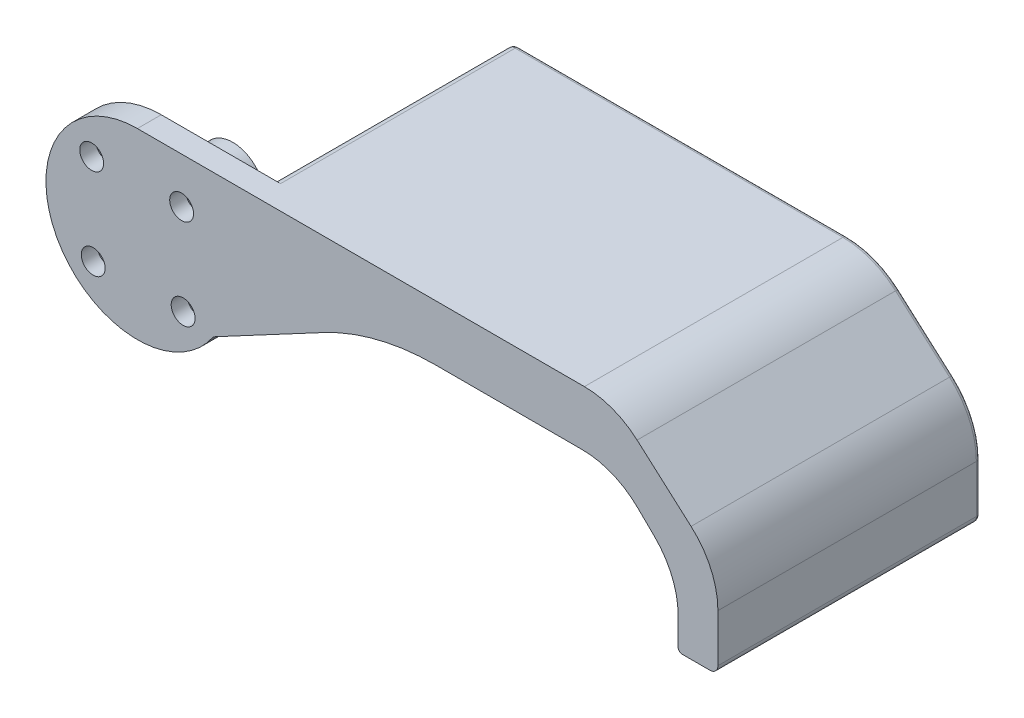
from build123d import *

# Parameters (mm, degrees)
SZKIC1_R                    = 11.5
DODANIE_WYCI_GNI_CIE1_DEPTH = 3
SZKIC2_R                    = 4
DODANIE_WYCI_GNI_CIE2_DEPTH = 9
SZKIC3_R                    = 1.5
WYTNIJ_WYCI_GNI_CIE1_DEPTH  = 2
DODANIE_WYCI_GNI_CIE3_DEPTH = 3
DODANIE_WYCI_GNI_CIE4_DEPTH = 30
ZAOKR_GLENIE1_R             = 10
ZAOKR_GLENIE2_R             = 30
ZAOKR_GLENIE6_R             = 1
ZAOKR_GLENIE8_R             = 0.5
ZAOKR_GLENIE9_R             = 0.5


with BuildPart() as part:
    # Szkic1 → Dodanie-wyciągnięcie1 (new body)
    with BuildSketch(Plane.XY):
        with Locations((68.25, -14)):
            Circle(SZKIC1_R)
    extrude(amount=DODANIE_WYCI_GNI_CIE1_DEPTH)

    # Szkic2 → Dodanie-wyciągnięcie2 (add)
    with BuildSketch(Plane(origin=(0, 0, 0), x_dir=(-1, 0, 0), z_dir=(0, 0, -1))):
        with Locations((-68.25, -14)):
            Circle(SZKIC2_R)
    extrude(amount=DODANIE_WYCI_GNI_CIE2_DEPTH)

    # Szkic3 → Wytnij-wyciągnięcie1 (cut)
    with BuildSketch(Plane.XY.offset(3)):
        with Locations((74.000947528, -19.561169169)):
            Circle(SZKIC3_R)
        with Locations((73.811169169, -8.249052472)):
            Circle(SZKIC3_R)
        with Locations((62.499052472, -8.438830831)):
            Circle(SZKIC3_R)
        with Locations((62.688830831, -19.750947528)):
            Circle(SZKIC3_R)
    extrude(amount=-WYTNIJ_WYCI_GNI_CIE1_DEPTH, mode=Mode.SUBTRACT)

    # Szkic4 → Dodanie-wyciągnięcie3 (add)
    with BuildSketch(Plane.XY.offset(3)):
        Polygon((68.25, -2.5), (128.25, -2.5), (141.25, -14), (141.25, -25.5), (136.25, -25.5), (136.25, -17.31662479), (128.25, -9.5), (98.25, -9.5), (77.80017301, -20.406574394), (76.895320055, -6.416567983), align=None)
    extrude(amount=-DODANIE_WYCI_GNI_CIE3_DEPTH)

    # Szkic6 → Dodanie-wyciągnięcie4 (add)
    with BuildSketch(Plane(origin=(0, 0, 0), x_dir=(-1, 0, 0), z_dir=(0, 0, -1))):
        Polygon((-82.25, -2.5), (-128.25, -2.5), (-141.25, -14), (-141.25, -25.5), (-136.25, -25.5), (-136.25, -24.5), (-139.75, -24.5), (-139.75, -14.901008455), (-127.489427722, -4.5), (-82.25, -4.5), align=None)
    extrude(amount=DODANIE_WYCI_GNI_CIE4_DEPTH)

    # Zaokrąglenie1
    zaokr_glenie1_edges = [part.edges().sort_by_distance(p)[0] for p in [
        (128.25, -2.5, -13.5),
        (141.25, -14, -13.5),
        (136.25, -17.31662479, 1.5),
        (128.25, -9.5, 1.5),
        (139.75, -14.901008455, -15),
        (127.489427722, -4.5, -15),
    ]]
    fillet(zaokr_glenie1_edges, radius=ZAOKR_GLENIE1_R)

    # Zaokrąglenie2
    zaokr_glenie2_edges = [part.edges().sort_by_distance(p)[0] for p in [
        (98.25, -9.5, 1.5),
    ]]
    fillet(zaokr_glenie2_edges, radius=ZAOKR_GLENIE2_R)

    # Zaokrąglenie6
    zaokr_glenie6_edges = [part.edges().sort_by_distance(p)[0] for p in [
        (141.25, -25.5, -13.5),
        (139.75, -24.5, -15),
        (82.25, -2.5, -15),
        (82.25, -4.5, -15),
    ]]
    fillet(zaokr_glenie6_edges, radius=ZAOKR_GLENIE6_R - 0.0001)  # a hair under: the kernel refuses the full size

    # Zaokrąglenie8
    zaokr_glenie8_edges = [part.edges().sort_by_distance(p)[0] for p in [
        (136.25, -25.5, -13.5),
        (136.25, -24.5, -15),
    ]]
    fillet(zaokr_glenie8_edges, radius=ZAOKR_GLENIE8_R - 0.0001)  # a hair under: the kernel refuses the full size

    # Zaokrąglenie9
    zaokr_glenie9_edges = [part.edges().sort_by_distance(p)[0] for p in [
        (141.25, -21.502571138, -30),
        (140.36749385, -14.397572751, -30),
        (128.004313516, -3.148538717, -30),
        (138.824438517, -15.329570819, -30),
        (127.264686983, -5.112328638, -30),
        (103.855795671, -2.5, -30),
        (138.5, -25.5, -30),
        (139.75, -21.515702231, -30),
        (140.957136071, -25.207136071, -30),
        (82.542863929, -4.207136071, -30),
        (82.542863929, -2.792863929, -30),
        (139.457136071, -24.207136071, -30),
        (137.75, -24.5, -30),
        (136.39641732, -24.64641732, -30),
        (136.39641732, -25.35358268, -30),
        (133.253669041, -9.38997751, -30),
        (103.534532162, -4.5, -30),
        (134.481584493, -8.012555513, -30),
    ]]
    fillet(zaokr_glenie9_edges, radius=ZAOKR_GLENIE9_R - 0.0001)  # a hair under: the kernel refuses the full size


solid = part.part
